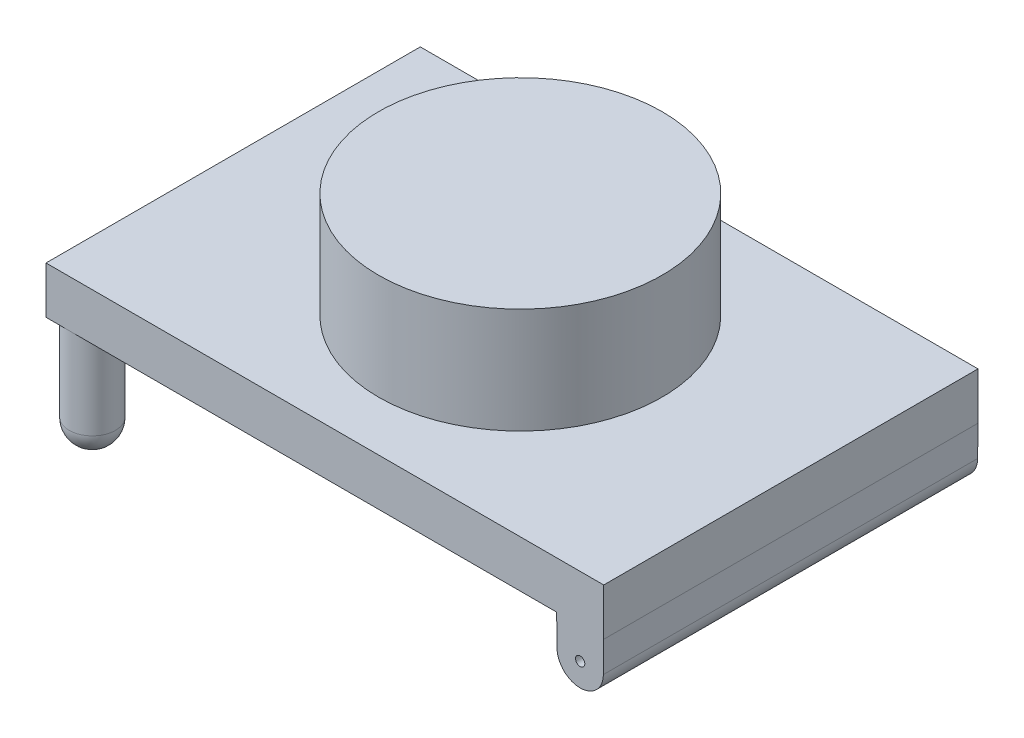
from build123d import *

# Parameters (mm, degrees)
SKETCH1_W           = 301
SKETCH1_H           = 202
BOSS_EXTRUDE1_DEPTH = 60
CUT_EXTRUDE1_DEPTH  = 259.948353924
SKETCH5_R           = 12.5
BOSS_EXTRUDE2_DEPTH = 59.1
FILLET1_R           = 12.5
SKETCH2_R           = 2.5
CUT_EXTRUDE2_DEPTH  = 259.948353924
SKETCH6_R           = 76.5
BOSS_EXTRUDE3_DEPTH = 57


with BuildPart() as part:
    # Sketch1 → Boss-Extrude1 (new body)
    with BuildSketch(Plane(origin=(0, 0, 0), x_dir=(1, 0, 0), z_dir=(0, 1, 0))):
        Rectangle(SKETCH1_W, SKETCH1_H)
    extrude(amount=BOSS_EXTRUDE1_DEPTH)

    # Sketch4 → Cut-Extrude1 (cut, through all)
    with BuildSketch(Plane.XY.offset(101)):
        with BuildLine():
            Line((125.3, 18), (125.1, 34.6))
            Line((125.1, 34.6), (-150.5, 34.6))
            Line((-150.5, 34.6), (-150.5, 0))
            Line((-150.5, 0), (150.5, 0))
            Line((150.5, 0), (150.5, 34.6))
            Line((150.5, 34.6), (150.3, 18))
            ThreePointArc((150.3, 18), (137.8, 5.5), (125.3, 18))
        make_face()
    extrude(amount=-CUT_EXTRUDE1_DEPTH, mode=Mode.SUBTRACT)

    # Sketch5 → Boss-Extrude2 (add)
    with BuildSketch(Plane.XZ.offset(-34.6)):
        with Locations((-138, 88.5)):
            Circle(SKETCH5_R)
        with Locations((-138, -88.5)):
            Circle(SKETCH5_R)
    extrude(amount=BOSS_EXTRUDE2_DEPTH)

    # Fillet1
    fillet1_edges = [part.edges().sort_by_distance(p)[0] for p in [
        (-150.5, -24.5, -88.5),
        (-150.5, -24.5, 88.5),
    ]]
    fillet(fillet1_edges, radius=FILLET1_R)

    # Sketch2 → Cut-Extrude2 (cut, through all)
    with BuildSketch(Plane.XY.offset(101)):
        with Locations((137.8, 18)):
            Circle(SKETCH2_R)
    extrude(amount=-CUT_EXTRUDE2_DEPTH, mode=Mode.SUBTRACT)

    # Sketch6 → Boss-Extrude3 (add)
    with BuildSketch(Plane(origin=(0, 60, 0), x_dir=(1, 0, 0), z_dir=(0, 1, 0))):
        with Locations((2, 2.5)):
            Circle(SKETCH6_R)
    extrude(amount=BOSS_EXTRUDE3_DEPTH)


solid = part.part
